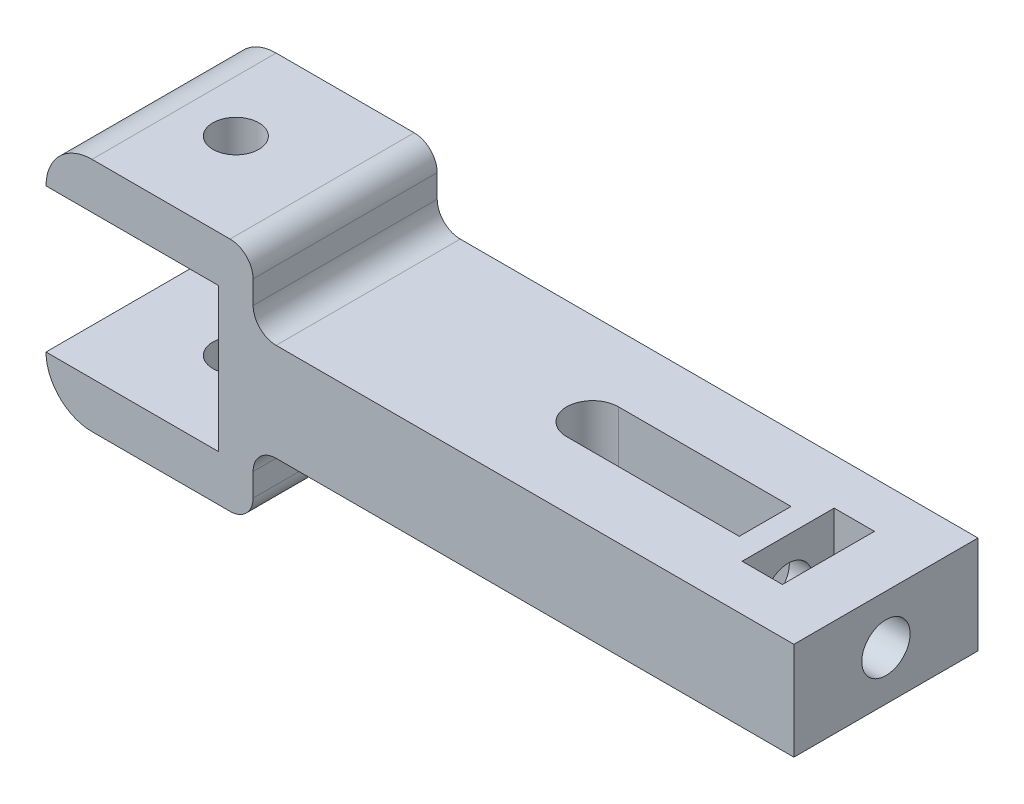
from build123d import *

# Parameters (mm, degrees)
BOSS_EXTRUDE1_DEPTH = 16
SKETCH2_W           = 3.5
SKETCH2_H           = 8
CUT_EXTRUDE1_DEPTH  = 69.492700341
CUT_EXTRUDE2_REACH  = 70.493
SKETCH3_R           = 2.1
FILLET1_R           = 2
SKETCH4_R           = 9
CUT_EXTRUDE3_DEPTH  = 12.5
SKETCH5_R           = 2
CUT_EXTRUDE4_DEPTH  = 71.008928002
FILLET2_R           = 4


with BuildPart() as part:
    # Sketch1 → Boss-Extrude1 (new body)
    with BuildSketch(Plane.XY):
        Polygon((0, 0), (-47, 0), (-47, 6), (-65, 6), (-65, 2), (-50, 2), (-50, -10.5), (-65, -10.5), (-65, -14.5), (-47, -14.5), (-47, -8.5), (0, -8.5), align=None)
    extrude(amount=BOSS_EXTRUDE1_DEPTH)

    # Sketch2 → Cut-Extrude1 (cut, through all)
    with BuildSketch(Plane(origin=(0, 0, 0), x_dir=(1, 0, 0), z_dir=(0, 1, 0))):
        with Locations((-6.75, -8)):
            Rectangle(SKETCH2_W, SKETCH2_H)
        with BuildLine():
            Line((-25.5, -10.25), (-10.5, -10.25))
            Line((-10.5, -10.25), (-10.5, -5.75))
            Line((-10.5, -5.75), (-25.5, -5.75))
            ThreePointArc((-25.5, -5.75), (-27.750000403, -8), (-25.5, -10.25))
        make_face()
    extrude(amount=-CUT_EXTRUDE1_DEPTH, mode=Mode.SUBTRACT)

    # Cut-Extrude2: up to this face of the body (flat: up to its plane)
    cut_extrude2_end = Plane(part.part.faces().sort_by_distance((-10.5, -4.25, 8))[0])
    # Sketch3 → Cut-Extrude2 (cut, up to the picked face)
    with BuildSketch(Plane(origin=(0, 0, 0), x_dir=(0, 0, -1), z_dir=(1, 0, 0)), mode=Mode.PRIVATE) as cut_extrude2_sk1:
        with Locations(Location((-8, -4.25, 0), (0, 0, 90))):
            Circle(SKETCH3_R)
    cut_extrude2_tool1 = split(extrude(cut_extrude2_sk1.sketch, amount=-CUT_EXTRUDE2_REACH, mode=Mode.PRIVATE), bisect_by=cut_extrude2_end, keep=Keep.BOTH, mode=Mode.PRIVATE)
    add(cut_extrude2_tool1.solids().sort_by(Axis((0, -4.25, 8), (-1, 0, 0)))[0], mode=Mode.SUBTRACT)

    # Fillet1
    fillet1_edges = [part.edges().sort_by_distance(p)[0] for p in [
        (-47, -8.5, 8),
        (-47, -14.5, 8),
        (-47, 6, 8),
        (-47, 0, 8),
    ]]
    fillet(fillet1_edges, radius=FILLET1_R)

    # Sketch4 → Cut-Extrude3 (cut)
    with BuildSketch(Plane(origin=(0, -10.5, 0), x_dir=(1, 0, 0), z_dir=(0, 1, 0))):
        with Locations((-57, -8)):
            Circle(SKETCH4_R)
    extrude(amount=CUT_EXTRUDE3_DEPTH, mode=Mode.SUBTRACT)

    # Sketch5 → Cut-Extrude4 (cut, through all)
    with BuildSketch(Plane(origin=(0, 6, 0), x_dir=(1, 0, 0), z_dir=(0, 1, 0))):
        with Locations(Location((-56.5, -8, 0), (0, 0, 180))):
            Circle(SKETCH5_R)
    extrude(amount=-CUT_EXTRUDE4_DEPTH, mode=Mode.SUBTRACT)

    # Fillet2
    fillet2_edges = [part.edges().sort_by_distance(p)[0] for p in [
        (-65, -14.5, 8),
        (-65, 6, 8),
    ]]
    fillet(fillet2_edges, radius=FILLET2_R - 0.0001)  # a hair under: the kernel refuses the full size


solid = part.part
